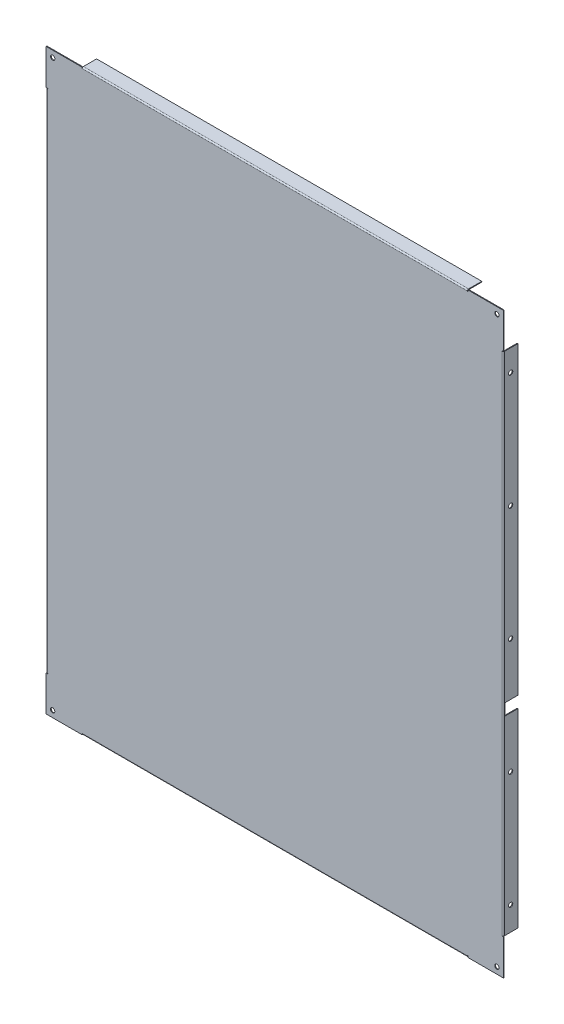
from build123d import *

# Parameters (mm, degrees)
SKETCH_1_W                        = 635
SKETCH_1_H                        = 803
SM_BASE_FLANGE_1_DEPTH            = 1
SM_EDGE_FLANGE_1_STRIP_W          = 5.4732
SM_EDGE_FLANGE_1_STRIP_H          = 1
SM_EDGE_FLANGE_1_STRIP_CUT_DEPTH  = 535
SM_EDGE_FLANGE_1_RELIEF_W         = 5.9732
SM_EDGE_FLANGE_1_RELIEF_H         = 0.5
SM_EDGE_FLANGE_1_RELIEF_CUT_DEPTH = 1
SM_EDGE_FLANGE_1_DEPTH            = 535
SM_EDGE_FLANGE_2_STRIP_W          = 5.4732
SM_EDGE_FLANGE_2_STRIP_H          = 1
SM_EDGE_FLANGE_2_STRIP_CUT_DEPTH  = 535
SM_EDGE_FLANGE_2_RELIEF_W         = 5.9732
SM_EDGE_FLANGE_2_RELIEF_H         = 0.5
SM_EDGE_FLANGE_2_RELIEF_CUT_DEPTH = 1
SM_EDGE_FLANGE_2_DEPTH            = 535
SM_EDGE_FLANGE_3_STRIP_W          = 5.4732
SM_EDGE_FLANGE_3_STRIP_H          = 1
SM_EDGE_FLANGE_3_STRIP_CUT_DEPTH  = 703
SM_EDGE_FLANGE_3_RELIEF_W         = 5.9732
SM_EDGE_FLANGE_3_RELIEF_H         = 0.5
SM_EDGE_FLANGE_3_RELIEF_CUT_DEPTH = 1
SM_EDGE_FLANGE_3_DEPTH            = 703
SM_EDGE_FLANGE_3_FLAT_DEPTH       = 1
SKETCH_15_R                       = 3
CUT_EXTRUDE_2_DEPTH               = 752.549898543
SKETCH_16_R                       = 3
CUT_EXTRUDE_3_DEPTH               = 513.258235659


# Sheet-metal steps are written as plain solids
with BuildPart() as part:
    # Sketch 1 → 基体-法兰1 (new body)
    with BuildSketch(Plane.XY):
        Rectangle(SKETCH_1_W, SKETCH_1_H)
    extrude(amount=-SM_BASE_FLANGE_1_DEPTH)

    # 边线-法兰1 strip (across the edge) → 边线-法兰1 strip cut (cut)
    with BuildSketch(Plane(origin=(-267.5, 401.5, -1), x_dir=(0, -1, 0), z_dir=(1, 0, 0))):
        with Locations((-1, -0.5)):
            Rectangle(SM_EDGE_FLANGE_1_STRIP_W, SM_EDGE_FLANGE_1_STRIP_H)
    extrude(amount=SM_EDGE_FLANGE_1_STRIP_CUT_DEPTH, mode=Mode.SUBTRACT)

    # 边线-法兰1 relief (on the sheet) → 边线-法兰1 relief cut (cut)
    with BuildSketch(Plane(origin=(-267.5, 399.7634, -1), x_dir=(0, -1, 0), z_dir=(0, 0, -1))):
        with Locations((-2.4866, 0.25)):
            Rectangle(SM_EDGE_FLANGE_1_RELIEF_W, SM_EDGE_FLANGE_1_RELIEF_H)
        with Locations((-2.4866, -535.25)):
            Rectangle(SM_EDGE_FLANGE_1_RELIEF_W, SM_EDGE_FLANGE_1_RELIEF_H)
    extrude(amount=-SM_EDGE_FLANGE_1_RELIEF_CUT_DEPTH, mode=Mode.SUBTRACT)

    # 边线-法兰1 section (across the edge) → 边线-法兰1 (add)
    with BuildSketch(Plane(origin=(-267.5, 401.5, -1), x_dir=(0, -1, 0), z_dir=(1, 0, 0))):
        with BuildLine():
            Line((0, 0.7366), (0, 19))
            Line((0, 19), (1, 19))
            Line((1, 19), (1, 0.7366))
            ThreePointArc((1, 0.7366), (1.215745145, 0.215745145), (1.7366, 0))
            Line((1.7366, 0), (1.7366, -1))
            ThreePointArc((1.7366, -1), (0.508638364, -0.491361636), (0, 0.7366))
        make_face()
    extrude(amount=SM_EDGE_FLANGE_1_DEPTH)

    # 边线-法兰2 strip (across the edge) → 边线-法兰2 strip cut (cut)
    with BuildSketch(Plane(origin=(267.5, -401.5, -1), x_dir=(0, 1, 0), z_dir=(-1, 0, 0))):
        with Locations((-1, -0.5)):
            Rectangle(SM_EDGE_FLANGE_2_STRIP_W, SM_EDGE_FLANGE_2_STRIP_H)
    extrude(amount=SM_EDGE_FLANGE_2_STRIP_CUT_DEPTH, mode=Mode.SUBTRACT)

    # 边线-法兰2 relief (on the sheet) → 边线-法兰2 relief cut (cut)
    with BuildSketch(Plane(origin=(267.5, -399.7634, -1), x_dir=(0, 1, 0), z_dir=(0, 0, -1))):
        with Locations((-2.4866, 0.25)):
            Rectangle(SM_EDGE_FLANGE_2_RELIEF_W, SM_EDGE_FLANGE_2_RELIEF_H)
        with Locations((-2.4866, -535.25)):
            Rectangle(SM_EDGE_FLANGE_2_RELIEF_W, SM_EDGE_FLANGE_2_RELIEF_H)
    extrude(amount=-SM_EDGE_FLANGE_2_RELIEF_CUT_DEPTH, mode=Mode.SUBTRACT)

    # 边线-法兰2 section (across the edge) → 边线-法兰2 (add)
    with BuildSketch(Plane(origin=(267.5, -401.5, -1), x_dir=(0, 1, 0), z_dir=(-1, 0, 0))):
        with BuildLine():
            Line((0, 0.7366), (0, 19))
            Line((0, 19), (1, 19))
            Line((1, 19), (1, 0.7366))
            ThreePointArc((1, 0.7366), (1.215745145, 0.215745145), (1.7366, 0))
            Line((1.7366, 0), (1.7366, -1))
            ThreePointArc((1.7366, -1), (0.508638364, -0.491361636), (0, 0.7366))
        make_face()
    extrude(amount=SM_EDGE_FLANGE_2_DEPTH)

    # 边线-法兰3 strip (across the edge) → 边线-法兰3 strip cut (cut)
    with BuildSketch(Plane(origin=(317.5, 351.5, -1), x_dir=(-1, 0, 0), z_dir=(0, -1, 0))):
        with Locations((-1, -0.5)):
            Rectangle(SM_EDGE_FLANGE_3_STRIP_W, SM_EDGE_FLANGE_3_STRIP_H)
    sm_edge_flange_3_strip_cut = extrude(amount=SM_EDGE_FLANGE_3_STRIP_CUT_DEPTH, mode=Mode.SUBTRACT)

    # 边线-法兰3 relief (on the sheet) → 边线-法兰3 relief cut (cut)
    with BuildSketch(Plane(origin=(315.7634, 351.5, -1), x_dir=(-1, 0, 0), z_dir=(0, 0, -1))):
        with Locations((-2.4866, 0.25)):
            Rectangle(SM_EDGE_FLANGE_3_RELIEF_W, SM_EDGE_FLANGE_3_RELIEF_H)
        with Locations((-2.4866, -703.25)):
            Rectangle(SM_EDGE_FLANGE_3_RELIEF_W, SM_EDGE_FLANGE_3_RELIEF_H)
    sm_edge_flange_3_relief_cut = extrude(amount=-SM_EDGE_FLANGE_3_RELIEF_CUT_DEPTH, mode=Mode.SUBTRACT)

    # 边线-法兰3 bend section (across the edge) → 边线-法兰3 (add)
    with BuildSketch(Plane(origin=(317.5, 351.5, -1), x_dir=(-1, 0, 0), z_dir=(0, -1, 0))):
        with BuildLine():
            Line((0, 0.7366), (1, 0.7366))
            ThreePointArc((1, 0.7366), (1.215745145, 0.215745145), (1.7366, 0))
            Line((1.7366, 0), (1.7366, -1))
            ThreePointArc((1.7366, -1), (0.508638364, -0.491361636), (0, 0.7366))
        make_face()
    sm_edge_flange_3 = extrude(amount=SM_EDGE_FLANGE_3_DEPTH)

    # 边线-法兰3 profile (on flange) → 边线-法兰3 flat (add)
    with BuildSketch(Plane(origin=(317.5, 0, -1), x_dir=(0, -1, 0), z_dir=(1, 0, 0))):
        Polygon((351.5, 0.7366), (351.5, 19), (87.5, 19), (87.5, 1), (71.5, 1), (71.5, 19), (-351.5, 19), (-351.5, 0.7366), align=None)
    sm_edge_flange_3_flat = extrude(amount=-SM_EDGE_FLANGE_3_FLAT_DEPTH)

    # 镜向1: 边线-法兰3 strip cut, 边线-法兰3 relief cut, 边线-法兰3, 边线-法兰3 flat across plane
    add(sm_edge_flange_3_strip_cut.mirror(Plane(origin=(0, 0, 0), x_dir=(0, 0, 1), z_dir=(1, 0, 0))), mode=Mode.SUBTRACT)
    add(sm_edge_flange_3_relief_cut.mirror(Plane(origin=(0, 0, 0), x_dir=(0, 0, 1), z_dir=(1, 0, 0))), mode=Mode.SUBTRACT)
    add(sm_edge_flange_3.mirror(Plane(origin=(0, 0, 0), x_dir=(0, 0, 1), z_dir=(1, 0, 0))))
    add(sm_edge_flange_3_flat.mirror(Plane(origin=(0, 0, 0), x_dir=(0, 0, 1), z_dir=(1, 0, 0))))

    # 草图15 → 切除-拉伸2 (cut, through all)
    with BuildSketch(Plane(origin=(317.5, 0, 0), x_dir=(0, 0, -1), z_dir=(1, 0, 0))):
        with Locations((10, 321.5)):
            Circle(SKETCH_15_R)
        with Locations((10, 161.5)):
            Circle(SKETCH_15_R)
        with Locations((10, 1.5)):
            Circle(SKETCH_15_R)
        with Locations((10, -158.5)):
            Circle(SKETCH_15_R)
        with Locations((10, -318.5)):
            Circle(SKETCH_15_R)
    extrude(amount=-CUT_EXTRUDE_2_DEPTH, mode=Mode.SUBTRACT)

    # 草图16 → 切除-拉伸3 (cut, through all)
    with BuildSketch(Plane.XY):
        with Locations((308.5, 392.5)):
            Circle(SKETCH_16_R)
        with Locations((308.5, -392.5)):
            Circle(SKETCH_16_R)
        with Locations((-308.5, 392.5)):
            Circle(SKETCH_16_R)
        with Locations((-308.5, -392.5)):
            Circle(SKETCH_16_R)
    extrude(amount=-CUT_EXTRUDE_3_DEPTH, mode=Mode.SUBTRACT)


solid = part.part
